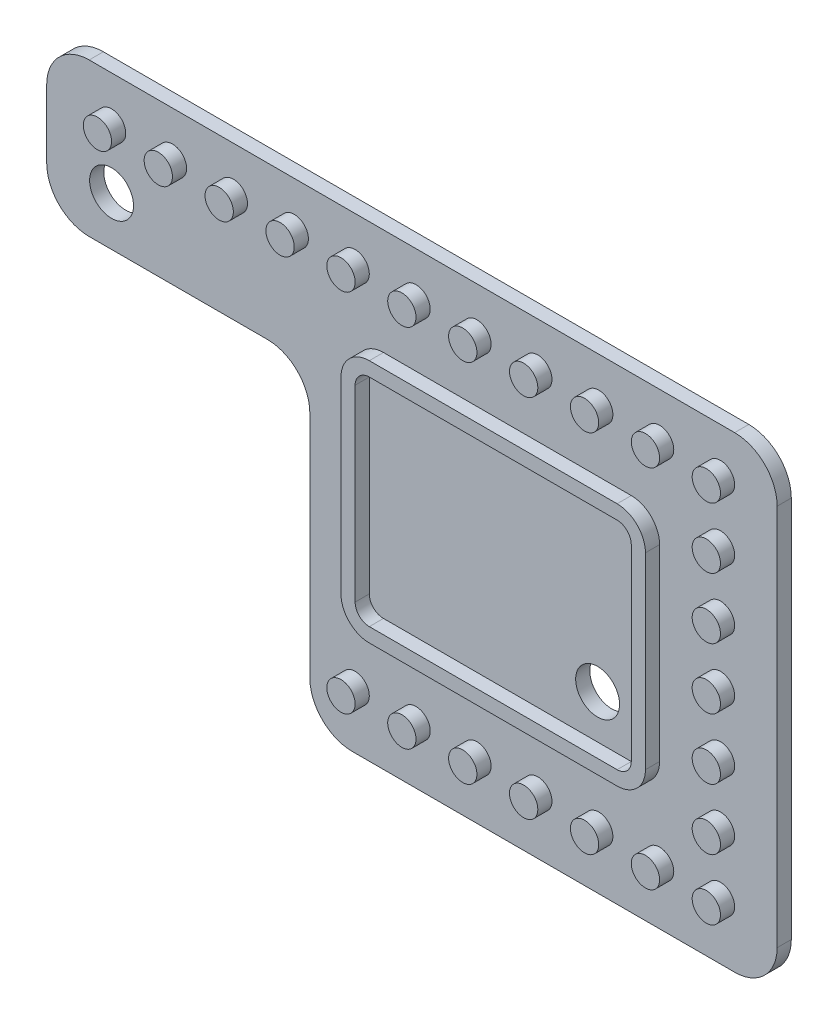
from build123d import *

# Parameters (mm, degrees)
BOSS_EXTRUDE1_DEPTH = 1
SKETCH2_R           = 1
BOSS_EXTRUDE2_DEPTH = 1
FILLET1_R           = 3
CUT_EXTRUDE1_REACH  = 72.674
SKETCH3_R           = 1.55


with BuildPart() as part:
    # Sketch1 → Boss-Extrude1 (new body)
    with BuildSketch(Plane.XY):
        Polygon((-8, 5), (-8, 38), (-59.580513121, 38), (-59.580513121, 27.2), (-41, 27.2), (-41, 5), align=None)
    extrude(amount=BOSS_EXTRUDE1_DEPTH)

    # Sketch2 → Boss-Extrude2 (add)
    # profile 1 of 24: a face of its own
    with BuildSketch(Plane.XY.offset(1)):
        with Locations((-12, 9)):
            Circle(SKETCH2_R)
    # profile 2 of 24: a face of its own
    with BuildSketch(Plane.XY.offset(1)):
        with Locations((-12, 13.3)):
            Circle(SKETCH2_R)
    # profile 3 of 24: a face of its own
    with BuildSketch(Plane.XY.offset(1)):
        with Locations((-12, 17.6)):
            Circle(SKETCH2_R)
    # profile 4 of 24: a face of its own
    with BuildSketch(Plane.XY.offset(1)):
        with Locations((-12, 21.9)):
            Circle(SKETCH2_R)
    # profile 5 of 24: a face of its own
    with BuildSketch(Plane.XY.offset(1)):
        with Locations((-12, 26.2)):
            Circle(SKETCH2_R)
    # profile 6 of 24: a face of its own
    with BuildSketch(Plane.XY.offset(1)):
        with Locations((-12, 30.5)):
            Circle(SKETCH2_R)
    # profile 7 of 24: a face of its own
    with BuildSketch(Plane.XY.offset(1)):
        with Locations((-12, 34.8)):
            Circle(SKETCH2_R)
    # profile 8 of 24: a face of its own
    with BuildSketch(Plane.XY.offset(1)):
        with Locations((-16.3, 9)):
            Circle(SKETCH2_R)
    # profile 9 of 24: a face of its own
    with BuildSketch(Plane.XY.offset(1)):
        with Locations((-20.6, 9)):
            Circle(SKETCH2_R)
    # profile 10 of 24: a face of its own
    with BuildSketch(Plane.XY.offset(1)):
        with Locations((-24.9, 9)):
            Circle(SKETCH2_R)
    # profile 11 of 24: a face of its own
    with BuildSketch(Plane.XY.offset(1)):
        with Locations((-29.2, 9)):
            Circle(SKETCH2_R)
    # profile 12 of 24: a face of its own
    with BuildSketch(Plane.XY.offset(1)):
        with Locations((-33.5, 9)):
            Circle(SKETCH2_R)
    # profile 13 of 24: a face of its own
    with BuildSketch(Plane.XY.offset(1)):
        with Locations((-37.8, 9)):
            Circle(SKETCH2_R)
    # profile 14 of 24: a face of its own
    with BuildSketch(Plane.XY.offset(1)):
        with Locations((-16.3, 34.8)):
            Circle(SKETCH2_R)
    # profile 15 of 24: a face of its own
    with BuildSketch(Plane.XY.offset(1)):
        with Locations((-20.6, 34.8)):
            Circle(SKETCH2_R)
    # profile 16 of 24: a face of its own
    with BuildSketch(Plane.XY.offset(1)):
        with Locations((-24.9, 34.8)):
            Circle(SKETCH2_R)
    # profile 17 of 24: a face of its own
    with BuildSketch(Plane.XY.offset(1)):
        with Locations((-29.2, 34.8)):
            Circle(SKETCH2_R)
    # profile 18 of 24: a face of its own
    with BuildSketch(Plane.XY.offset(1)):
        with Locations((-33.5, 34.8)):
            Circle(SKETCH2_R)
    # profile 19 of 24: a face of its own
    with BuildSketch(Plane.XY.offset(1)):
        with Locations((-37.8, 34.8)):
            Circle(SKETCH2_R)
    # profile 20 of 24: a face of its own
    with BuildSketch(Plane.XY.offset(1)):
        with Locations((-42.1, 34.8)):
            Circle(SKETCH2_R)
    # profile 21 of 24: a face of its own
    with BuildSketch(Plane.XY.offset(1)):
        with Locations((-46.4, 34.8)):
            Circle(SKETCH2_R)
    # profile 22 of 24: a face of its own
    with BuildSketch(Plane.XY.offset(1)):
        with Locations((-50.7, 34.8)):
            Circle(SKETCH2_R)
    # profile 23 of 24: a face of its own
    with BuildSketch(Plane.XY.offset(1)):
        with Locations((-55, 34.8)):
            Circle(SKETCH2_R)
    # profile 24 of 24: a face of its own
    with BuildSketch(Plane.XY.offset(1)):
        with BuildLine():
            Line((-35.8, 30.5), (-18.3, 30.5))
            ThreePointArc((-18.3, 30.5), (-16.885786438, 29.914213562), (-16.3, 28.5))
            Line((-16.3, 28.5), (-16.3, 15.236025644))
            ThreePointArc((-16.3, 15.236025644), (-16.885786438, 13.821812082), (-18.3, 13.236025644))
            Line((-18.3, 13.236025644), (-35.8, 13.236025644))
            ThreePointArc((-35.8, 13.236025644), (-37.214213562, 13.821812082), (-37.8, 15.236025644))
            Line((-37.8, 15.236025644), (-37.8, 28.5))
            ThreePointArc((-37.8, 28.5), (-37.214213562, 29.914213562), (-35.8, 30.5))
        make_face()
        with BuildLine():
            Line((-35.8, 29.5), (-18.3, 29.5))
            ThreePointArc((-18.3, 29.5), (-17.592893219, 29.207106781), (-17.3, 28.5))
            Line((-17.3, 28.5), (-17.3, 15.236025644))
            ThreePointArc((-17.3, 15.236025644), (-17.592893219, 14.528918863), (-18.3, 14.236025644))
            Line((-18.3, 14.236025644), (-35.8, 14.236025644))
            ThreePointArc((-35.8, 14.236025644), (-36.507106781, 14.528918863), (-36.8, 15.236025644))
            Line((-36.8, 15.236025644), (-36.8, 28.5))
            ThreePointArc((-36.8, 28.5), (-36.507106781, 29.207106781), (-35.8, 29.5))
        make_face(mode=Mode.SUBTRACT)
    extrude(amount=BOSS_EXTRUDE2_DEPTH)

    # Fillet1
    fillet1_edges = [part.edges().sort_by_distance(p)[0] for p in [
        (-8, 38, 0.5),
        (-8, 5, 0.5),
        (-41, 5, 0.5),
        (-41, 27.2, 0.5),
        (-59.580513121, 27.2, 0.5),
        (-59.580513121, 38, 0.5),
    ]]
    fillet(fillet1_edges, radius=FILLET1_R)

    # Sketch3 → Cut-Extrude1 (cut, up to next)
    with BuildSketch(Plane.XY.offset(1), mode=Mode.PRIVATE) as cut_extrude1_sk1:
        with Locations((-20.677552724, 17.314204089)):
            Circle(SKETCH3_R)
    cut_extrude1_tool1 = extrude(cut_extrude1_sk1.sketch, amount=-CUT_EXTRUDE1_REACH, mode=Mode.PRIVATE) & part.part
    # Sketch3 → Cut-Extrude1 (cut, up to next)
    with BuildSketch(Plane.XY.offset(1), mode=Mode.PRIVATE) as cut_extrude1_sk2:
        with Locations((-55, 30.651276125)):
            Circle(SKETCH3_R)
    cut_extrude1_tool2 = extrude(cut_extrude1_sk2.sketch, amount=-CUT_EXTRUDE1_REACH, mode=Mode.PRIVATE) & part.part
    add(cut_extrude1_tool1.solids().sort_by_distance((-20.677553, 17.314204, 1))[0], mode=Mode.SUBTRACT)
    add(cut_extrude1_tool2.solids().sort_by_distance((-55, 30.651276, 1))[0], mode=Mode.SUBTRACT)


solid = part.part
